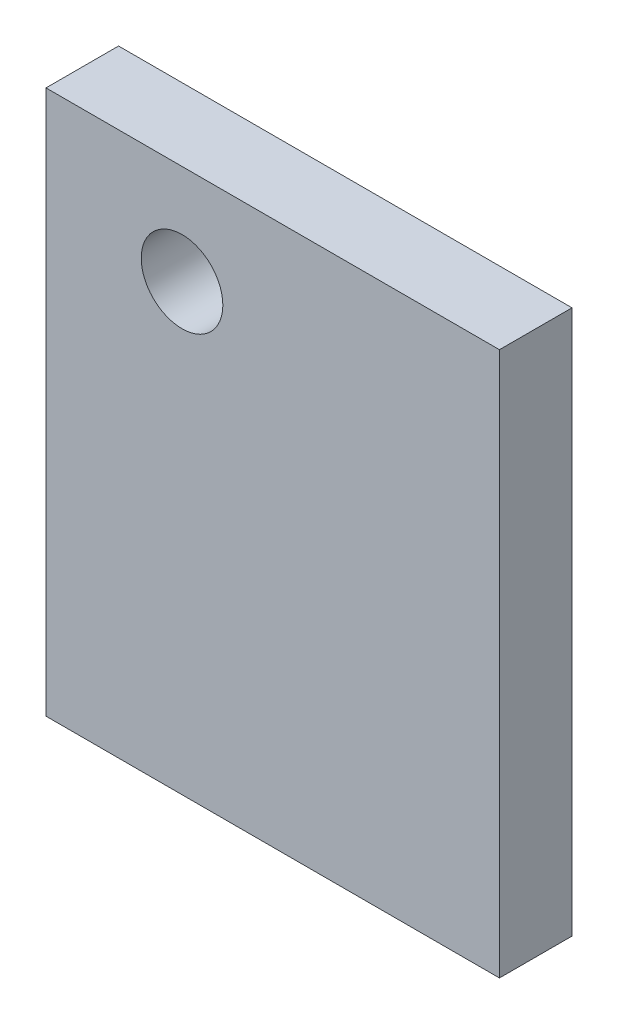
from build123d import *

# Parameters (mm, degrees)
SKETCH1_W           = 50
SKETCH1_H           = 60
SKETCH1_R           = 4.5
BOSS_EXTRUDE1_DEPTH = 8


with BuildPart() as part:
    # Sketch1 → Boss-Extrude1 (new body)
    with BuildSketch(Plane.XY):
        Rectangle(SKETCH1_W, SKETCH1_H)
        with Locations((-10, 19)):
            Circle(SKETCH1_R, mode=Mode.SUBTRACT)
    extrude(amount=BOSS_EXTRUDE1_DEPTH)


solid = part.part
